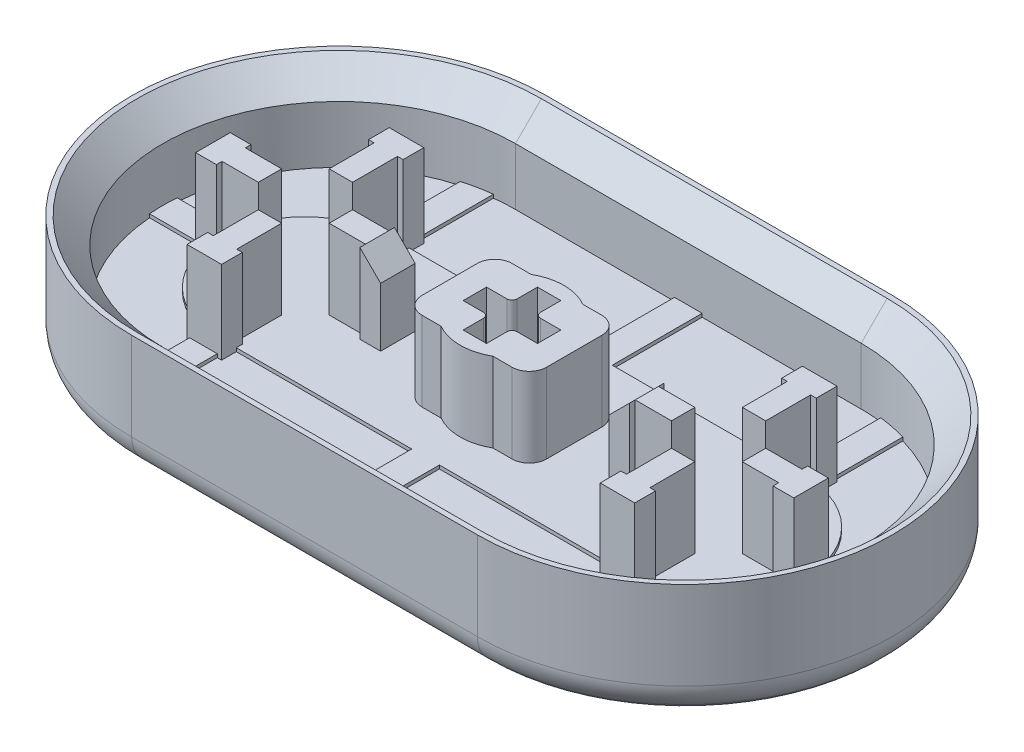
from build123d import *

# Parameters (mm, degrees)
BUTTON_TOP_DEPTH   = 1.8
BUTTON_WALLS_DEPTH = 4.8
OFFSET_2_DEPTH     = 0.2
STEM_START         = 0.2
STEM_HOUSING_DEPTH = 4.6
STAB_HOUSING_DEPTH = 4.8
SPOKES_DEPTH       = 0.2
CHAMFER1_SIZE      = 1.5
FILLET2_R          = 1
CHAMFER2_SIZE      = 1.2


# Read off the part's stored shape, not the designer's step: stab housing
with BuildPart() as part:
    # Sketch1 → button top (new body)
    with BuildSketch(Plane(origin=(0, 0, 0), x_dir=(1, 0, 0), z_dir=(0, 1, 0))):
        with BuildLine():
            Line((10, -12), (-10, -12))
            ThreePointArc((-10, -12), (-22, 0), (-10, 12))
            Line((-10, 12), (10, 12))
            ThreePointArc((10, 12), (22, 0), (10, -12))
        make_face()
    extrude(amount=BUTTON_TOP_DEPTH)

    # Sketch2 → button walls (add)
    with BuildSketch(Plane(origin=(0, 1.8, 0), x_dir=(1, 0, 0), z_dir=(0, 1, 0))):
        with BuildLine():
            Line((-10, 12), (10, 12))
            ThreePointArc((10, 12), (22, 0), (10, -12))
            Line((10, -12), (-10, -12))
            ThreePointArc((-10, -12), (-22, 0), (-10, 12))
        make_face()
        with BuildLine():
            Line((-10, 10.2), (10, 10.2))
            ThreePointArc((10, 10.2), (20.2, 0), (10, -10.2))
            Line((10, -10.2), (-10, -10.2))
            ThreePointArc((-10, -10.2), (-20.2, 0), (-10, 10.2))
        make_face(mode=Mode.SUBTRACT)
    extrude(amount=BUTTON_WALLS_DEPTH)

    # Sketch5 → offset 2 (add)
    with BuildSketch(Plane(origin=(0, 1.8, 0), x_dir=(1, 0, 0), z_dir=(0, 1, 0))):
        with BuildLine():
            Line((-12, 5), (12, 5))
            ThreePointArc((12, 5), (17, 0), (12, -5))
            Line((12, -5), (-12, -5))
            ThreePointArc((-12, -5), (-17, 0), (-12, 5))
        make_face()
    extrude(amount=OFFSET_2_DEPTH)

    # Sketch3 → stem housing (add)
    # profile 1 of 5: a face of its own
    with BuildSketch(Plane(origin=(0, 1.8, 0), x_dir=(1, 0, 0), z_dir=(0, 1, 0)).offset(STEM_START)):
        with BuildLine():
            Line((-3.6, 2.6), (-3.6, -2.6))
            Line((-3.6, -2.6), (-1.496662955, -2.6))
            ThreePointArc((-1.496662955, -2.6), (-3, 0), (-1.496662955, 2.6))
            Line((-1.496662955, 2.6), (-3.6, 2.6))
        make_face()
    # profile 2 of 5: a face of its own
    with BuildSketch(Plane(origin=(0, 1.8, 0), x_dir=(1, 0, 0), z_dir=(0, 1, 0)).offset(STEM_START)):
        with BuildLine():
            ThreePointArc((3, 0), (2.597112711, -1.501667596), (1.496662955, -2.6))
            Line((1.496662955, -2.6), (3.6, -2.6))
            Line((3.6, -2.6), (3.6, 2.6))
            Line((3.6, 2.6), (1.496662955, 2.6))
            ThreePointArc((1.496662955, 2.6), (2.597112711, 1.501667596), (3, 0))
        make_face()
    # profile 3 of 5: a face of its own
    with BuildSketch(Plane(origin=(0, 1.8, 0), x_dir=(1, 0, 0), z_dir=(0, 1, 0)).offset(STEM_START)):
        with BuildLine():
            Line((1.496662955, -2.6), (-1.496662955, -2.6))
            ThreePointArc((-1.496662955, -2.6), (0, -3), (1.496662955, -2.6))
        make_face()
    # profile 4 of 5: a face of its own
    with BuildSketch(Plane(origin=(0, 1.8, 0), x_dir=(1, 0, 0), z_dir=(0, 1, 0)).offset(STEM_START)):
        with BuildLine():
            ThreePointArc((1.496662955, 2.6), (0, 3), (-1.496662955, 2.6))
            Line((-1.496662955, 2.6), (1.496662955, 2.6))
        make_face()
    # profile 5 of 5: a face of its own
    with BuildSketch(Plane(origin=(0, 1.8, 0), x_dir=(1, 0, 0), z_dir=(0, 1, 0)).offset(STEM_START)):
        with BuildLine():
            ThreePointArc((-1.496662955, 2.6), (-3, 0), (-1.496662955, -2.6))
            Line((-1.496662955, -2.6), (1.496662955, -2.6))
            ThreePointArc((1.496662955, -2.6), (2.597112711, -1.501667596), (3, 0))
            ThreePointArc((3, 0), (2.597112711, 1.501667596), (1.496662955, 2.6))
            Line((1.496662955, 2.6), (-1.496662955, 2.6))
        make_face()
        with BuildLine():
            ThreePointArc((-0.975, 0.675), (-0.762867966, 0.762867966), (-0.675, 0.975))
            Line((-0.675, 0.975), (-0.675, 2.15))
            Line((-0.675, 2.15), (0.675, 2.15))
            Line((0.675, 2.15), (0.675, 0.975))
            ThreePointArc((0.675, 0.975), (0.762867966, 0.762867966), (0.975, 0.675))
            Line((0.975, 0.675), (2.15, 0.675))
            Line((2.15, 0.675), (2.15, -0.675))
            Line((2.15, -0.675), (0.975, -0.675))
            ThreePointArc((0.975, -0.675), (0.762867966, -0.762867966), (0.675, -0.975))
            Line((0.675, -0.975), (0.675, -2.15))
            Line((0.675, -2.15), (-0.675, -2.15))
            Line((-0.675, -2.15), (-0.675, -0.975))
            ThreePointArc((-0.675, -0.975), (-0.762867966, -0.762867966), (-0.975, -0.675))
            Line((-0.975, -0.675), (-2.15, -0.675))
            Line((-2.15, -0.675), (-2.15, 0.675))
            Line((-2.15, 0.675), (-0.975, 0.675))
        make_face(mode=Mode.SUBTRACT)
    extrude(amount=STEM_HOUSING_DEPTH)

    # stab housing outline → stab housing (add)
    with BuildSketch(Plane(origin=(0, 1.8, 0), x_dir=(1, 0, 0), z_dir=(0, 1, 0))):
        Polygon((16.1, 1), (16.1, 0.675), (14, 0.675), (14, -0.675), (16.1, -0.675), (16.1, -1), (17.3, -1), (17.3, 1), align=None)
        Polygon((12.95, 4.65), (12.95, 4.908920452), (12.95, 5.85), (10.95, 5.85), (10.95, 4.65), (11.275, 4.65), (11.275, 2.05), (12.625, 2.05), (12.625, 4.65), align=None)
        Polygon((12.95, -5.85), (12.95, -4.908920452), (12.95, -4.65), (12.625, -4.65), (12.625, -2.05), (11.275, -2.05), (11.275, -4.65), (10.95, -4.65), (10.95, -5.85), align=None)
        Polygon((7.8, 0.675), (7.8, 1), (6.6, 1), (6.6, -1), (7.8, -1), (7.8, -0.675), (9.9, -0.675), (9.9, 0.675), align=None)
        Polygon((-6.6, 1), (-7.8, 1), (-7.8, 0.675), (-9.9, 0.675), (-9.9, -0.675), (-7.8, -0.675), (-7.8, -1), (-6.6, -1), align=None)
        Polygon((-16.1, 0.675), (-16.1, 1), (-17.3, 1), (-17.3, -1), (-16.1, -1), (-16.1, -0.675), (-14, -0.675), (-14, 0.675), align=None)
        Polygon((-12.95, -4.65), (-12.95, -4.908920452), (-12.95, -5.85), (-10.95, -5.85), (-10.95, -4.65), (-11.275, -4.65), (-11.275, -2.05), (-12.625, -2.05), (-12.625, -4.65), align=None)
        Polygon((-12.95, 5.85), (-12.95, 4.908920452), (-12.95, 4.65), (-12.625, 4.65), (-12.625, 2.05), (-11.275, 2.05), (-11.275, 4.65), (-10.95, 4.65), (-10.95, 5.85), align=None)
    extrude(amount=STAB_HOUSING_DEPTH)

    # Sketch4 → spokes (add)
    with BuildSketch(Plane(origin=(0, 1.8, 0), x_dir=(1, 0, 0), z_dir=(0, 1, 0))):
        with BuildLine():
            Line((-0.8, 3), (-0.8, 10.2))
            ThreePointArc((-0.8, 10.2), (0, 11), (0.8, 10.2))
            Line((0.8, 10.2), (0.8, 3))
            ThreePointArc((0.8, 3), (0, 2.2), (-0.8, 3))
        make_face()
        with BuildLine():
            Line((17, -0.8), (20.2, -0.8))
            ThreePointArc((20.2, -0.8), (21, 0), (20.2, 0.8))
            Line((20.2, 0.8), (17, 0.8))
            ThreePointArc((17, 0.8), (16.2, 0), (17, -0.8))
        make_face()
        with BuildLine():
            Line((11.2, 4.935585072), (11.2, 10.2))
            ThreePointArc((11.2, 10.2), (12, 11), (12.8, 10.2))
            Line((12.8, 10.2), (12.8, 4.935585072))
            ThreePointArc((12.8, 4.935585072), (12, 4.135585072), (11.2, 4.935585072))
        make_face()
        with BuildLine():
            Line((-12.8, 4.935585072), (-12.8, 10.2))
            ThreePointArc((-12.8, 10.2), (-12, 11), (-11.2, 10.2))
            Line((-11.2, 10.2), (-11.2, 4.935585072))
            ThreePointArc((-11.2, 4.935585072), (-12, 4.135585072), (-12.8, 4.935585072))
        make_face()
        with BuildLine():
            Line((-17, -0.8), (-20.2, -0.8))
            ThreePointArc((-20.2, -0.8), (-21, 0), (-20.2, 0.8))
            Line((-20.2, 0.8), (-17, 0.8))
            ThreePointArc((-17, 0.8), (-16.2, 0), (-17, -0.8))
        make_face()
        with BuildLine():
            Line((-0.8, -3), (-0.8, -10.2))
            ThreePointArc((-0.8, -10.2), (0, -11), (0.8, -10.2))
            Line((0.8, -10.2), (0.8, -3))
            ThreePointArc((0.8, -3), (0, -2.2), (-0.8, -3))
        make_face()
        with BuildLine():
            Line((11.2, -4.935585072), (11.2, -10.2))
            ThreePointArc((11.2, -10.2), (12, -11), (12.8, -10.2))
            Line((12.8, -10.2), (12.8, -4.935585072))
            ThreePointArc((12.8, -4.935585072), (12, -4.135585072), (11.2, -4.935585072))
        make_face()
        with BuildLine():
            Line((-12.8, -4.935585072), (-12.8, -10.2))
            ThreePointArc((-12.8, -10.2), (-12, -11), (-11.2, -10.2))
            Line((-11.2, -10.2), (-11.2, -4.935585072))
            ThreePointArc((-11.2, -4.935585072), (-12, -4.135585072), (-12.8, -4.935585072))
        make_face()
    extrude(amount=SPOKES_DEPTH)

    # Chamfer1
    chamfer1_edges = [part.edges().sort_by_distance(p)[0] for p in [
        (-20.2, 6.6, 0),
        (0, 6.6, 10.2),
        (20.2, 6.6, 0),
        (0, 6.6, -10.2),
    ]]
    chamfer(chamfer1_edges, length=CHAMFER1_SIZE)

    # Cut-Sweep1: sweep along a path in Sketch10
    with BuildLine(Plane.XZ) as cut_sweep1_path:
        Line((-10, 12), (10, 12))
        ThreePointArc((10, 12), (22, 0), (10, -12))
        Line((10, -12), (-10, -12))
        ThreePointArc((-10, -12), (-22, 0), (-10, 12))
    # Sketch6 → Cut-Sweep1 (sweep, cut)
    with BuildSketch(Plane.XY):
        with BuildLine():
            Line((-21.261522369, 0), (-21.461522369, 0.2))
            ThreePointArc((-21.461522369, 0.2), (-21.860054223, 0.79644507), (-22, 1.5))
            Line((-22, 1.5), (-22, 0))
            Line((-22, 0), (-21.261522369, 0))
        make_face()
    sweep(path=cut_sweep1_path.line, mode=Mode.SUBTRACT)

    # Fillet2
    fillet2_edges = [part.edges().sort_by_distance(p)[0] for p in [
        (-3.6, 4.3, -2.6),
        (-3.6, 4.3, 2.6),
        (3.6, 4.3, 2.6),
        (3.6, 4.3, -2.6),
    ]]
    fillet(fillet2_edges, radius=FILLET2_R)

    # Chamfer2
    chamfer2_edges = [part.edges().sort_by_distance(p)[0] for p in [
        (-6.6, 6.6, 0),
        (6.6, 6.6, 0),
    ]]
    chamfer(chamfer2_edges, length=CHAMFER2_SIZE)


solid = part.part
